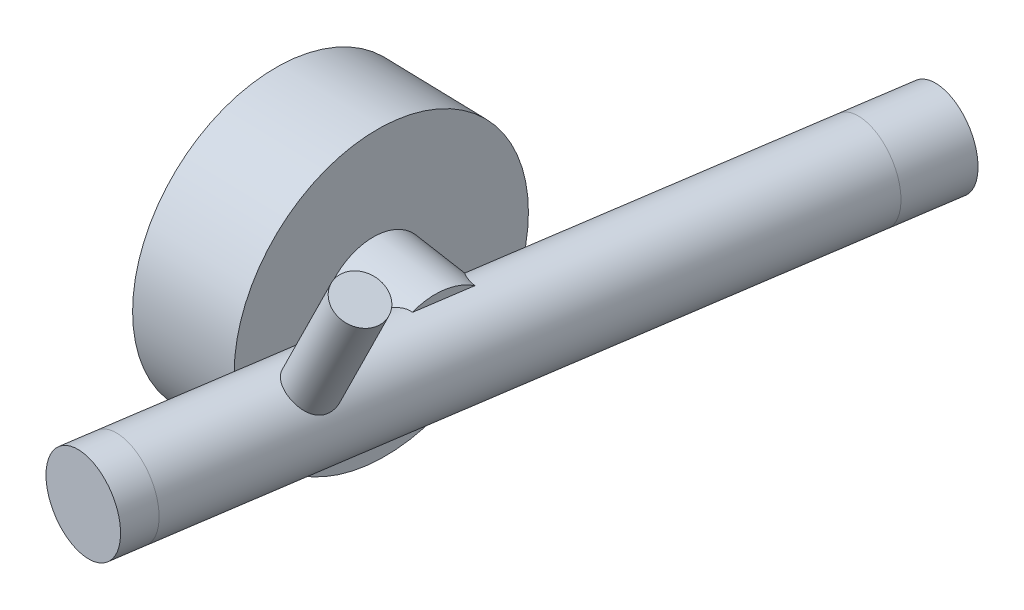
from build123d import *

# Parameters (mm, degrees)
SUSP_RL_UCA_BALL_JOINT_PROFILE_R  = 17
SUSP_RL_LCA_BALL_JOINT_PROFILE_R  = 17
SUSP_RL_UPRIGHT_KINGPIN_START     = -15.170463608
SUSP_RL_UPRIGHT_KINGPIN_OUTLINE_R = 17
SUSP_RL_UPRIGHT_KINGPIN_DEPTH     = 237.229999131
SUSP_RL_UPRIGHT_SPINDLE_PROFILE_R = 20
SUSP_RL_UPRIGHT_ARM_PROFILE_R     = 9
SUSP_RL_HUB_PROFILE_R             = 55


# Read off the part's stored shape, not the designer's step: SUSP_RL_upright_kingpin
with BuildPart() as part:
    # SUSP_RL_UCA_ball_joint: sweep along a curve in space
    with BuildLine() as susp_rl_uca_ball_joint_path:
        Line((-521.613651, 1419.6, -302.481439), (-517.770606, 1419.6, -328.195852))
    # SUSP_RL_UCA_ball_joint profile (on start of the path) → SUSP_RL_UCA_ball_joint (sweep)
    with BuildSketch(Plane(origin=(-521.613651, 1419.6, -302.481439), x_dir=(-0.9890158620797268, 0, -0.14780941970894487), z_dir=(0.14780941970894487, 0, -0.9890158620797268))):
        Circle(SUSP_RL_UCA_BALL_JOINT_PROFILE_R)
    sweep(path=susp_rl_uca_ball_joint_path.line)


with BuildPart() as body_2:
    # SUSP_RL_LCA_ball_joint: sweep along a curve in space
    with BuildLine() as susp_rl_lca_ball_joint_path:
        Line((-560.521522, 1419.6, -42.1427938), (-556.678478, 1419.6, -67.8572062))
    # SUSP_RL_LCA_ball_joint profile (on start of the path) → SUSP_RL_LCA_ball_joint (sweep)
    with BuildSketch(Plane(origin=(-560.521522, 1419.6, -42.1427938), x_dir=(-0.9890158671980833, 0, -0.14780938546121916), z_dir=(0.14780938546121916, 0, -0.9890158671980833))):
        Circle(SUSP_RL_LCA_BALL_JOINT_PROFILE_R)
    sweep(path=susp_rl_lca_ball_joint_path.line)


with BuildPart() as susp_rl_upright_kingpin_tool:
    # SUSP_RL_upright_kingpin outline → SUSP_RL_upright_kingpin (new body)
    with BuildSketch(Plane(origin=(0, 0, 0), x_dir=(0.9890158635477251, 0, 0.14780940988633906), z_dir=(0.14780940988633903, 0, -0.9890158635477251)).offset(SUSP_RL_UPRIGHT_KINGPIN_START)):
        with Locations((-560.593778922, -1419.6)):
            Circle(SUSP_RL_UPRIGHT_KINGPIN_OUTLINE_R)
    extrude(amount=SUSP_RL_UPRIGHT_KINGPIN_DEPTH)


with BuildPart() as part_1:
    add(part.part)


with BuildPart() as part_2:
    # SUSP_RL_upright_kingpin: joined with susp_rl_upright_kingpin_tool
    add(part_1.part.fuse(susp_rl_upright_kingpin_tool.part, body_2.part, tol=0.00001))

    # SUSP_RL_upright_spindle: sweep along a curve in space
    with BuildLine() as susp_rl_upright_spindle_path:
        Line((-542.552954, 1419.6, -162.373292), (-593.584449, 1419.6, -170))
    # SUSP_RL_upright_spindle profile (on start of the path) → SUSP_RL_upright_spindle (sweep)
    with BuildSketch(Plane(origin=(-542.552954, 1419.6, -162.373292), x_dir=(0.14780941059704947, 0, -0.9890158634415087), z_dir=(-0.9890158634415087, 0, -0.14780941059704947))):
        Circle(SUSP_RL_UPRIGHT_SPINDLE_PROFILE_R)
    sweep(path=susp_rl_upright_spindle_path.line)

    # SUSP_RL_upright_arm: sweep along a curve in space
    with BuildLine() as susp_rl_upright_arm_path:
        Line((-549.94905, 1419.6, -112.88486), (-520.81, 1474.2, -108.53))
    # SUSP_RL_upright_arm profile (on start of the path) → SUSP_RL_upright_arm (sweep)
    with BuildSketch(Plane(origin=(-549.94905, 1419.6, -112.88486), x_dir=(0.8822250985406449, -0.47082786186137016, 0), z_dir=(0.46966656036901244, 0.8800490817699289, 0.07019213450982756))):
        Circle(SUSP_RL_UPRIGHT_ARM_PROFILE_R)
    sweep(path=susp_rl_upright_arm_path.line)

    # SUSP_RL_hub: sweep along a curve in space
    with BuildLine() as susp_rl_hub_path:
        Line((-573.591303, 1419.6, -169.476461), (-613.577596, 1419.6, -170.523539))
    # SUSP_RL_hub profile (on start of the path) → SUSP_RL_hub (sweep)
    with BuildSketch(Plane(origin=(-573.591303, 1419.6, -169.476461), x_dir=(0.026176949998200902, 0, -0.9996573249312944), z_dir=(-0.9996573249312944, 0, -0.026176949998200902))):
        Circle(SUSP_RL_HUB_PROFILE_R)
    sweep(path=susp_rl_hub_path.line)


solid = part_2.part
